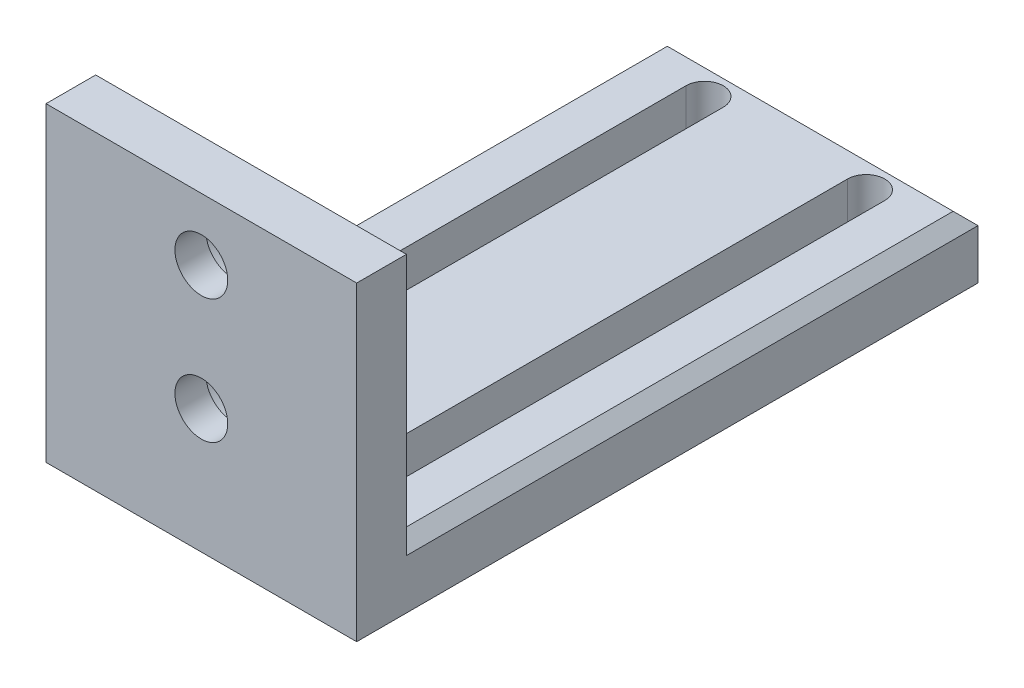
from build123d import *

# Parameters (mm, degrees)
SKETCH1_W           = 50
SKETCH1_H           = 90
BOSS_EXTRUDE1_DEPTH = 10
SKETCH2_W           = 50
SKETCH2_H           = 50
SKETCH2_R           = 4.25
BOSS_EXTRUDE2_DEPTH = 10
SKETCH3_R           = 8.5
CUT_EXTRUDE1_DEPTH  = 5
CHAMFER1_SIZE       = 2


with BuildPart() as part:
    # Sketch1 → Boss-Extrude1 (new body)
    with BuildSketch(Plane(origin=(0, 0, 0), x_dir=(1, 0, 0), z_dir=(0, 1, 0))):
        with Locations((25, 45)):
            Rectangle(SKETCH1_W, SKETCH1_H)
        with BuildLine():
            Line((9, 6), (9, 84))
            ThreePointArc((9, 84), (12, 87), (15, 84))
            Line((15, 84), (15, 6))
            ThreePointArc((15, 6), (12, 3), (9, 6))
        make_face(mode=Mode.SUBTRACT)
        with BuildLine():
            Line((35, 6), (35, 84))
            ThreePointArc((35, 84), (38, 87), (41, 84))
            Line((41, 84), (41, 6))
            ThreePointArc((41, 6), (38, 3), (35, 6))
        make_face(mode=Mode.SUBTRACT)
    extrude(amount=BOSS_EXTRUDE1_DEPTH)

    # Sketch2 → Boss-Extrude2 (add)
    with BuildSketch(Plane.XY):
        with Locations((25, 25)):
            Rectangle(SKETCH2_W, SKETCH2_H)
        with Locations((25, 40)):
            Circle(SKETCH2_R, mode=Mode.SUBTRACT)
        with Locations((25, 20)):
            Circle(SKETCH2_R, mode=Mode.SUBTRACT)
    extrude(amount=BOSS_EXTRUDE2_DEPTH)

    # Sketch3 → Cut-Extrude1 (cut)
    with BuildSketch(Plane(origin=(0, 0, 0), x_dir=(-1, 0, 0), z_dir=(0, 0, -1))):
        with Locations((-25, 40)):
            Circle(SKETCH3_R)
        with Locations((-25, 20)):
            Circle(SKETCH3_R)
    extrude(amount=-CUT_EXTRUDE1_DEPTH, mode=Mode.SUBTRACT)

    # Chamfer1
    # the kernel refuses this chamfer: 2 mm, written as the material it takes off along each edge
    with BuildSketch(Plane(origin=(50, 10, 0), x_dir=(0.027495876610585623, -0.9996219169112968, 0), z_dir=(0, 0, -1))) as chamfer1_piece_1:
        Polygon((CHAMFER1_SIZE * 0.999621916911, CHAMFER1_SIZE * 0.0274958766106), (-CHAMFER1_SIZE * 0.0274958766106, CHAMFER1_SIZE * 0.999621916911), (0, 0), align=None)
    extrude(amount=95.143365976, mode=Mode.SUBTRACT)
    with BuildSketch(Plane(origin=(55.143365976, 10, -90), x_dir=(0, -0.9996219169112968, -0.027495876610589075), z_dir=(-1, 0, 0)), Plane(origin=(-5.143365976, 50, 0), x_dir=(0, 0.02749587661058563, 0.9996219169112968), z_dir=(1, 0, 0))) as chamfer1_piece_2:
        Polygon((CHAMFER1_SIZE * 0.999621916911, CHAMFER1_SIZE * 0.0274958766106), (-CHAMFER1_SIZE * 0.0274958766106, CHAMFER1_SIZE * 0.999621916911), (0, 0), align=None)
    extrude(amount=60.286731952, mode=Mode.SUBTRACT)
    with BuildSketch(Plane(origin=(50, 55.143365976, 0), x_dir=(0.02749587661058563, 0, 0.9996219169112968), z_dir=(0, -1, 0))) as chamfer1_piece_3:
        Polygon((CHAMFER1_SIZE * 0.999621916911, CHAMFER1_SIZE * 0.0274958766106), (-CHAMFER1_SIZE * 0.0274958766106, CHAMFER1_SIZE * 0.999621916911), (0, 0), align=None)
    extrude(amount=45.143365976, mode=Mode.SUBTRACT)
    with BuildSketch(Plane(origin=(0, 10, 0), x_dir=(0.9996219169112968, 0, -0.027495876610586372), z_dir=(0, 1, 0))) as chamfer1_piece_4:
        Polygon((CHAMFER1_SIZE * 0.999621916911, -CHAMFER1_SIZE * 0.0274958766106), (-CHAMFER1_SIZE * 0.0274958766106, -CHAMFER1_SIZE * 0.999621916911), (0, 0), align=None)
    extrude(amount=45.143365976, mode=Mode.SUBTRACT)
    with BuildSketch(Plane(origin=(0, 10, -95.143365976), x_dir=(0.9996219169112968, 0.027495876610586494, 0), z_dir=(0, 0, 1))) as chamfer1_piece_5:
        Polygon((CHAMFER1_SIZE * 0.999621916911, -CHAMFER1_SIZE * 0.0274958766106), (-CHAMFER1_SIZE * 0.0274958766106, -CHAMFER1_SIZE * 0.999621916911), (0, 0), align=None)
    extrude(amount=95.143365976, mode=Mode.SUBTRACT)
    with BuildSketch(Plane(origin=(50, 55.143365976, 0), x_dir=(0.02749587661058563, 0, 0.9996219169112968), z_dir=(0, -1, 0))) as chamfer1_piece_6a_section:
        Polygon((CHAMFER1_SIZE * 0.999621916911, CHAMFER1_SIZE * 0.0274958766106), (-CHAMFER1_SIZE * 0.0274958766106, CHAMFER1_SIZE * 0.999621916911), (0, 0), align=None)
    chamfer1_piece_6a = extrude(amount=50.286731952, mode=Mode.PRIVATE)
    chamfer1_piece_6a = split(chamfer1_piece_6a, bisect_by=Plane(origin=(49.340412746, 10, 0.659587254), z_dir=(0, -1, 0)), keep=Keep.TOP, mode=Mode.PRIVATE)
    with BuildSketch(Plane(origin=(50, 10, 5.143365976), x_dir=(0.027495876610585623, -0.9996219169112968, 0), z_dir=(0, 0, -1))) as chamfer1_piece_6b_section:
        Polygon((CHAMFER1_SIZE * 0.999621916911, CHAMFER1_SIZE * 0.0274958766106), (-CHAMFER1_SIZE * 0.0274958766106, CHAMFER1_SIZE * 0.999621916911), (0, 0), align=None)
    chamfer1_piece_6b = extrude(amount=100.286731952, mode=Mode.PRIVATE)
    chamfer1_piece_6b = split(chamfer1_piece_6b, bisect_by=Plane(origin=(49.340412746, 9.340412746, 0), z_dir=(0, 0, 1)), keep=Keep.TOP, mode=Mode.PRIVATE)
    chamfer1_piece_6 = chamfer1_piece_6a & chamfer1_piece_6b
    add(chamfer1_piece_6, mode=Mode.SUBTRACT)
    with BuildSketch(Plane(origin=(0, 4.856634024, 0), x_dir=(0.9996219169112968, 0, -0.027495876610586372), z_dir=(0, 1, 0))) as chamfer1_piece_7a_section:
        Polygon((CHAMFER1_SIZE * 0.999621916911, -CHAMFER1_SIZE * 0.0274958766106), (-CHAMFER1_SIZE * 0.0274958766106, -CHAMFER1_SIZE * 0.999621916911), (0, 0), align=None)
    chamfer1_piece_7a = extrude(amount=50.286731952, mode=Mode.PRIVATE)
    chamfer1_piece_7a = split(chamfer1_piece_7a, bisect_by=Plane(origin=(0.659587254, 10, 0.659587254), z_dir=(0, -1, 0)), keep=Keep.TOP, mode=Mode.PRIVATE)
    with BuildSketch(Plane(origin=(0, 10, -95.143365976), x_dir=(0.9996219169112968, 0.027495876610586494, 0), z_dir=(0, 0, 1))) as chamfer1_piece_7b_section:
        Polygon((CHAMFER1_SIZE * 0.999621916911, -CHAMFER1_SIZE * 0.0274958766106), (-CHAMFER1_SIZE * 0.0274958766106, -CHAMFER1_SIZE * 0.999621916911), (0, 0), align=None)
    chamfer1_piece_7b = extrude(amount=100.286731952, mode=Mode.PRIVATE)
    chamfer1_piece_7b = split(chamfer1_piece_7b, bisect_by=Plane(origin=(0.659587254, 9.340412746, 0), z_dir=(0, 0, 1)), keep=Keep.TOP, mode=Mode.PRIVATE)
    chamfer1_piece_7 = chamfer1_piece_7a & chamfer1_piece_7b
    add(chamfer1_piece_7, mode=Mode.SUBTRACT)


solid = part.part
